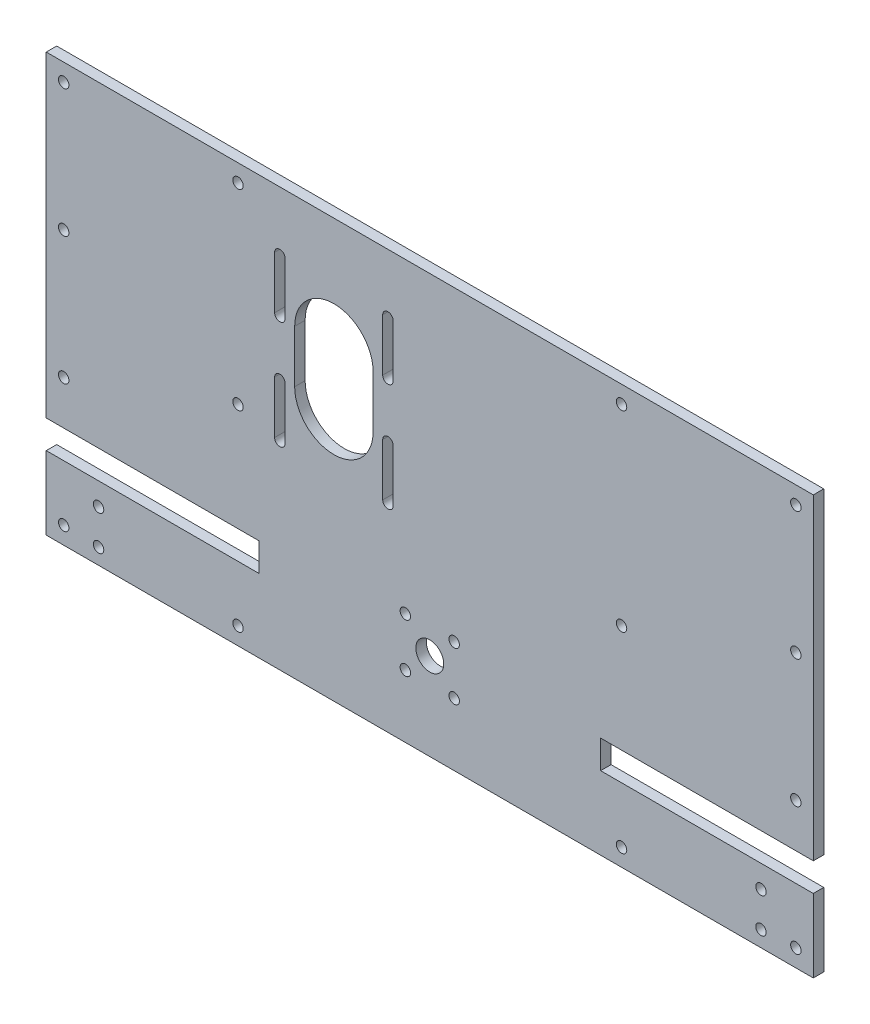
from build123d import *

# Parameters (mm, degrees)
ESQUISSE1_R             = 1.5
BOSS_EXTRU_1_DEPTH      = 3
ESQUISSE2_R             = 1.5
ENL_V_MAT_EXTRU_2_DEPTH = 3
ESQUISSE3_R             = 4
ESQUISSE3_R_2           = 1.5
ENL_V_MAT_EXTRU_3_DEPTH = 10
ESQUISSE4_W             = 100
ESQUISSE4_H             = 21.457187309
ENL_V_MAT_EXTRU_4_DEPTH = 10


with BuildPart() as part:
    # Esquisse1 → Boss.-Extru.1 (new body)
    with BuildSketch(Plane.XY):
        Polygon((-50, -65), (50, -65), (50, -55), (110, -55), (110, -34), (49, -34), (49, -25.9), (110, -25.9), (110, 65), (-110, 65), (-110, -25.9), (-49, -25.9), (-49, -34), (-110, -34), (-110, -55), (-50, -55), align=None)
        with BuildLine():
            ThreePointArc((-41.5, 2), (-43, 0.5), (-44.5, 2))
            Line((-44.5, 2), (-44.5, 17))
            ThreePointArc((-44.5, 17), (-43, 18.5), (-41.5, 17))
            Line((-41.5, 17), (-41.5, 2))
        make_face(mode=Mode.SUBTRACT)
        with BuildLine():
            Line((-10.5, 17), (-10.5, 2))
            ThreePointArc((-10.5, 2), (-12, 0.5), (-13.5, 2))
            Line((-13.5, 2), (-13.5, 17))
            ThreePointArc((-13.5, 17), (-12, 18.5), (-10.5, 17))
        make_face(mode=Mode.SUBTRACT)
        with BuildLine():
            ThreePointArc((-16.25, 17.5), (-27.5, 6.25), (-38.75, 17.5))
            Line((-38.75, 17.5), (-38.75, 32.5))
            ThreePointArc((-38.75, 32.5), (-27.5, 43.75), (-16.25, 32.5))
            Line((-16.25, 32.5), (-16.25, 17.5))
        make_face(mode=Mode.SUBTRACT)
        with BuildLine():
            ThreePointArc((-41.5, 33), (-43, 31.5), (-44.5, 33))
            Line((-44.5, 33), (-44.5, 48))
            ThreePointArc((-44.5, 48), (-43, 49.5), (-41.5, 48))
            Line((-41.5, 48), (-41.5, 33))
        make_face(mode=Mode.SUBTRACT)
        with BuildLine():
            Line((-10.5, 48), (-10.5, 33))
            ThreePointArc((-10.5, 33), (-12, 31.5), (-13.5, 33))
            Line((-13.5, 33), (-13.5, 48))
            ThreePointArc((-13.5, 48), (-12, 49.5), (-10.5, 48))
        make_face(mode=Mode.SUBTRACT)
        with Locations((-95, -40.455320997)):
            Circle(ESQUISSE1_R, mode=Mode.SUBTRACT)
        with Locations((-105, -50)):
            Circle(ESQUISSE1_R, mode=Mode.SUBTRACT)
        with Locations((-95, -50.455320997)):
            Circle(ESQUISSE1_R, mode=Mode.SUBTRACT)
        with Locations((-105, 60)):
            Circle(ESQUISSE1_R, mode=Mode.SUBTRACT)
        with Locations((-105, -13.333333333)):
            Circle(ESQUISSE1_R, mode=Mode.SUBTRACT)
        with Locations((-105, 23.333333333)):
            Circle(ESQUISSE1_R, mode=Mode.SUBTRACT)
        with Locations((105, 60)):
            Circle(ESQUISSE1_R, mode=Mode.SUBTRACT)
        with Locations((105, -13.333333333)):
            Circle(ESQUISSE1_R, mode=Mode.SUBTRACT)
        with Locations((105, 23.333333333)):
            Circle(ESQUISSE1_R, mode=Mode.SUBTRACT)
        with Locations((95, -40.455320997)):
            Circle(ESQUISSE1_R, mode=Mode.SUBTRACT)
        with Locations((95, -50.455320997)):
            Circle(ESQUISSE1_R, mode=Mode.SUBTRACT)
        with Locations((105, -50)):
            Circle(ESQUISSE1_R, mode=Mode.SUBTRACT)
    extrude(amount=BOSS_EXTRU_1_DEPTH)

    # Esquisse2 → Enlèv. mat.-Extru.2 (cut)
    with BuildSketch(Plane.XY.offset(3)):
        with Locations((45, -60)):
            Circle(ESQUISSE2_R)
        with Locations((-55, -50)):
            Circle(ESQUISSE2_R)
        with Locations((-55, 5)):
            Circle(ESQUISSE2_R)
        with Locations((-55, 60)):
            Circle(ESQUISSE2_R)
        with Locations((22.5, -60)):
            Circle(ESQUISSE2_R)
        with Locations((0, -60)):
            Circle(ESQUISSE2_R)
        with Locations((-22.5, -60)):
            Circle(ESQUISSE2_R)
        with Locations((-45, -60)):
            Circle(ESQUISSE2_R)
        with Locations((55, -50)):
            Circle(ESQUISSE2_R)
        with Locations((55, 5)):
            Circle(ESQUISSE2_R)
        with Locations((55, 60)):
            Circle(ESQUISSE2_R)
    extrude(amount=-ENL_V_MAT_EXTRU_2_DEPTH, mode=Mode.SUBTRACT)

    # Esquisse3 → Enlèv. mat.-Extru.3 (cut)
    with BuildSketch(Plane.XY.offset(3)):
        with Locations((0, -30)):
            Circle(ESQUISSE3_R)
        with Locations((-7, -23)):
            Circle(ESQUISSE3_R_2)
        with Locations((7, -23)):
            Circle(ESQUISSE3_R_2)
        with Locations((7, -37)):
            Circle(ESQUISSE3_R_2)
        with Locations((-7, -37)):
            Circle(ESQUISSE3_R_2)
    extrude(amount=-ENL_V_MAT_EXTRU_3_DEPTH, mode=Mode.SUBTRACT)

    # Esquisse4 → Enlèv. mat.-Extru.4 (cut)
    with BuildSketch(Plane.XY.offset(3)):
        with Locations((0, -65.728593655)):
            Rectangle(ESQUISSE4_W, ESQUISSE4_H)
    extrude(amount=-ENL_V_MAT_EXTRU_4_DEPTH, mode=Mode.SUBTRACT)


solid = part.part
